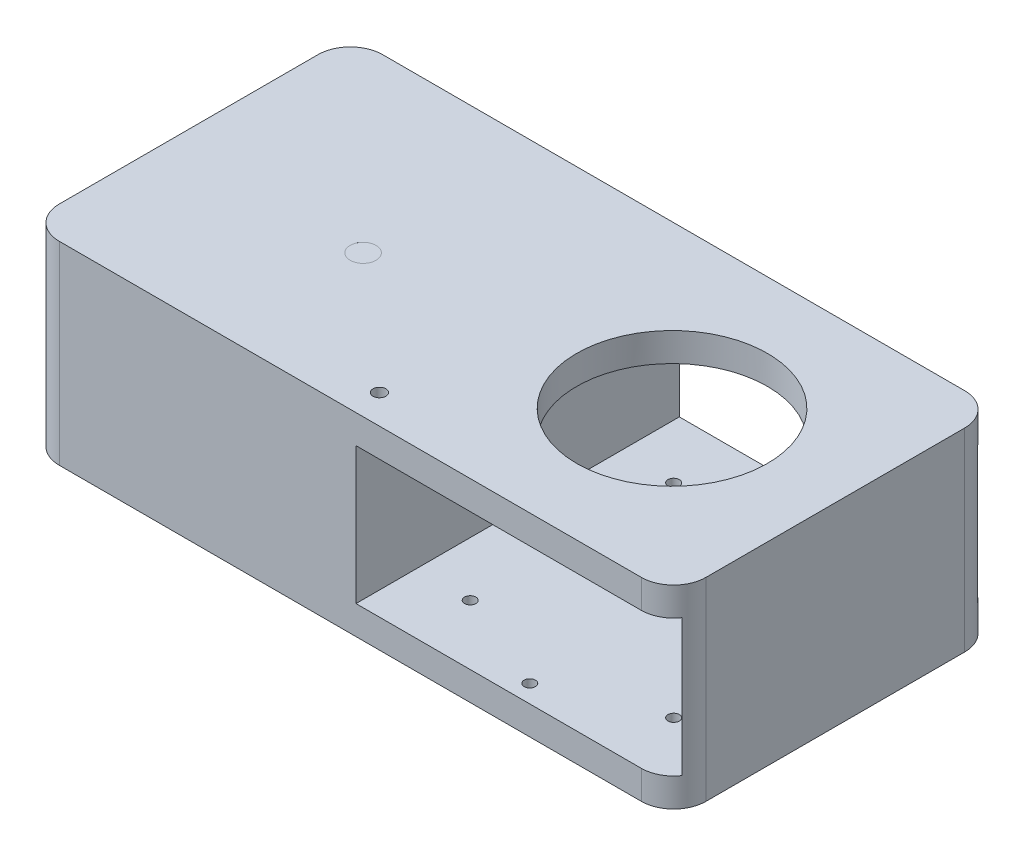
from build123d import *

# Parameters (mm, degrees)
SKETCH_1_W           = 200
SKETCH_1_H           = 100
EXTRUDE_2_DEPTH      = 60
SKETCH_4_W           = 96.5
SKETCH_4_H           = 42.3
CUT_EXTRUDE_7_DEPTH  = 180
SKETCH_10_R          = 2
CUT_EXTRUDE_12_DEPTH = 3
SKETCH_12_R          = 1
CUT_EXTRUDE_13_DEPTH = 3
SKETCH_16_R          = 29.5
CUT_EXTRUDE_14_DEPTH = 16
SKETCH_17_R          = 1.75
CUT_EXTRUDE_15_DEPTH = 10
SKETCH_22_R          = 4.000000002
CUT_EXTRUDE_16_DEPTH = 0.001
FILLET_1_R           = 10
FILLET_2_R           = 10
FILLET_3_R           = 10
FILLET_4_R           = 10


with BuildPart() as part:
    # 草图1 → 凸台-拉伸2 (new body)
    with BuildSketch(Plane(origin=(0, 0, 0), x_dir=(1, 0, 0), z_dir=(0, 1, 0))):
        Rectangle(SKETCH_1_W, SKETCH_1_H)
    extrude(amount=EXTRUDE_2_DEPTH)

    # 草图4 → 切除-拉伸7 (cut)
    with BuildSketch(Plane(origin=(0, 0, -50), x_dir=(-1, 0, 0), z_dir=(0, 0, -1))):
        with Locations((-50, 30)):
            Rectangle(SKETCH_4_W, SKETCH_4_H)
    extrude(amount=-CUT_EXTRUDE_7_DEPTH, mode=Mode.SUBTRACT)

    # 草图10 → 切除-拉伸12 (cut)
    with BuildSketch(Plane(origin=(0, 60, 0), x_dir=(1, 0, 0), z_dir=(0, 1, 0))):
        with Locations(Location((0, -41, 0), (0, 0, 270))):
            Circle(SKETCH_10_R)
    extrude(amount=-CUT_EXTRUDE_12_DEPTH, mode=Mode.SUBTRACT)

    # 草图12 → 切除-拉伸13 (cut)
    with BuildSketch(Plane(origin=(0, 0, -50), x_dir=(-1, 0, 0), z_dir=(0, 0, -1))):
        with Locations((0, 30)):
            Circle(SKETCH_12_R)
    extrude(amount=-CUT_EXTRUDE_13_DEPTH, mode=Mode.SUBTRACT)

    # 草图16 → 切除-拉伸14 (cut)
    with BuildSketch(Plane(origin=(0, 60, 0), x_dir=(1, 0, 0), z_dir=(0, 1, 0))):
        with Locations(Location((49.50076584, 0, 0), (0, 0, 270))):
            Circle(SKETCH_16_R)
    extrude(amount=-CUT_EXTRUDE_14_DEPTH, mode=Mode.SUBTRACT)

    # 草图17 → 切除-拉伸15 (cut)
    with BuildSketch(Plane(origin=(0, 8.85, 0), x_dir=(1, 0, 0), z_dir=(0, 1, 0))):
        with Locations(Location((50, -44.5, 0), (0, 0, 270))):
            Circle(SKETCH_17_R)
        with Locations(Location((18.533748237, -31.466251763, 0), (0, 0, 270))):
            Circle(SKETCH_17_R)
        with Locations(Location((5.5, 0, 0), (0, 0, 270))):
            Circle(SKETCH_17_R)
        with Locations(Location((18.533748237, 31.466251763, 0), (0, 0, 270))):
            Circle(SKETCH_17_R)
        with Locations(Location((50, 44.5, 0), (0, 0, 270))):
            Circle(SKETCH_17_R)
        with Locations(Location((81.466251763, 31.466251763, 0), (0, 0, 270))):
            Circle(SKETCH_17_R)
        with Locations(Location((94.5, 0, 0), (0, 0, 270))):
            Circle(SKETCH_17_R)
        with Locations(Location((81.466251763, -31.466251763, 0), (0, 0, 270))):
            Circle(SKETCH_17_R)
    extrude(amount=-CUT_EXTRUDE_15_DEPTH, mode=Mode.SUBTRACT)

    # 草图22 → 切除-拉伸16 (cut)
    with BuildSketch(Plane(origin=(0, 60, 0), x_dir=(1, 0, 0), z_dir=(0, 1, 0))):
        with Locations(Location((-39.943771533, -6.115069491, 0), (0, 0, 270))):
            Circle(SKETCH_22_R)
    extrude(amount=-CUT_EXTRUDE_16_DEPTH, mode=Mode.SUBTRACT)

    # 圆角1
    fillet_1_edges = [part.edges().sort_by_distance(p)[0] for p in [
        (-100, 30, -50),
    ]]
    fillet(fillet_1_edges, radius=FILLET_1_R)

    # 圆角2
    fillet_2_edges = [part.edges().sort_by_distance(p)[0] for p in [
        (-100, 30, 50),
    ]]
    fillet(fillet_2_edges, radius=FILLET_2_R)

    # 圆角3
    # the kernel refuses this fillet: 10 mm, written as the material it takes off along each edge
    with BuildSketch(Plane(origin=(100, -25, 50), x_dir=(-1, 0, 0), z_dir=(0, 1, 0))) as fillet_3_piece_1:
        with BuildLine():
            CenterArc((FILLET_3_R, -FILLET_3_R), FILLET_3_R, 90, 90)
            Line((0, -FILLET_3_R), (0, 0))
            Line((0, 0), (FILLET_3_R, 0))
        make_face()
    extrude(amount=110, mode=Mode.SUBTRACT)

    # 圆角4
    # the kernel refuses this fillet: 10 mm, written as the material it takes off along each edge
    with BuildSketch(Plane(origin=(100, -25, -50), x_dir=(0, 0, 1), z_dir=(0, 1, 0))) as fillet_4_piece_1:
        with BuildLine():
            CenterArc((FILLET_4_R, -FILLET_4_R), FILLET_4_R, 90, 90)
            Line((0, -FILLET_4_R), (0, 0))
            Line((0, 0), (FILLET_4_R, 0))
        make_face()
    extrude(amount=110, mode=Mode.SUBTRACT)


solid = part.part
